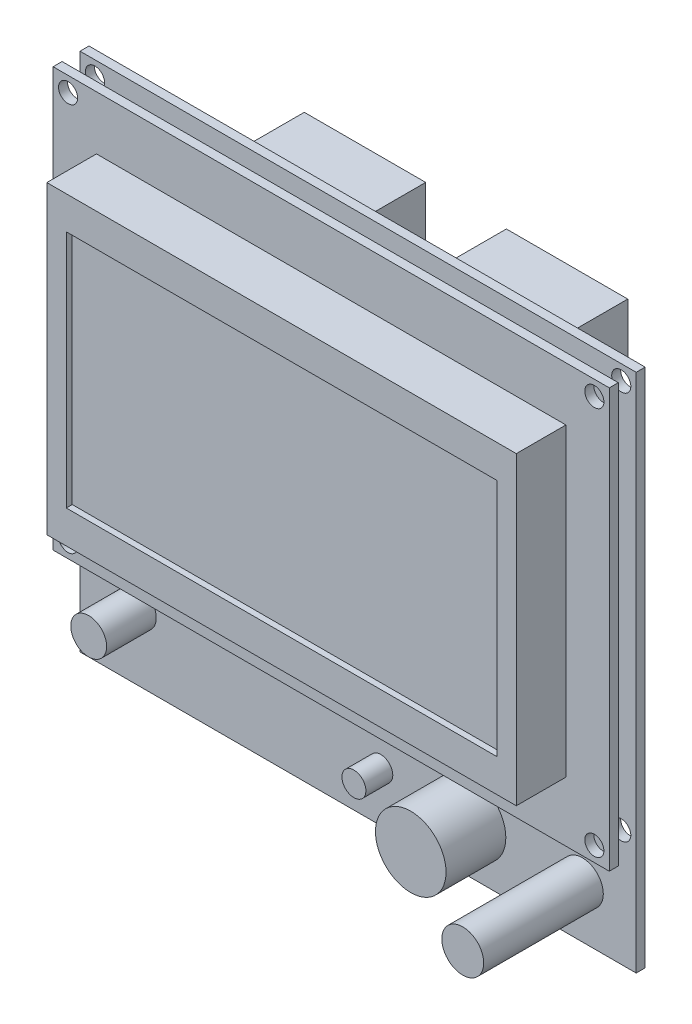
from build123d import *

# Parameters (mm, degrees)
ESBO_O1_W                  = 93
ESBO_O1_H                  = 87
RESSALTO_EXTRUS_O1_DEPTH   = 1.5
RESSALTO_EXTRUS_O2_START   = 3
ESBO_O3_W                  = 93
ESBO_O3_H                  = 70
RESSALTO_EXTRUS_O2_DEPTH   = 1.5
ESBO_O4_W                  = 78.5
ESBO_O4_H                  = 51
RESSALTO_EXTRUS_O3_DEPTH   = 8.3
ESBO_O5_W                  = 72
ESBO_O5_H                  = 40
CORTE_EXTRUS_O1_DEPTH      = 1
ESBO_O6_R                  = 3.5
RESSALTO_EXTRUS_O4_DEPTH   = 20
ESBO_O7_R                  = 2
RESSALTO_EXTRUS_O5_DEPTH   = 4.5
ESBO_O8_R                  = 5.9
RESSALTO_EXTRUS_O6_DEPTH   = 10
ESBO_O9_R                  = 3
RESSALTO_EXTRUS_O7_DEPTH   = 8.3
CORTE_EXTRUS_O2_DEPTH      = 66.534342142
CORTE_EXTRUS_O2_DEPTH_BACK = 66.534342142
ESBO_O10_R                 = 1.6
ESBO_O11_W                 = 20.3
ESBO_O11_H                 = 8.6
RESSALTO_EXTRUS_O8_DEPTH   = 15
ESBO_O12_W                 = 25.5
ESBO_O12_H                 = 26.5
RESSALTO_EXTRUS_O9_DEPTH   = 3


with BuildPart() as part:
    # Esboço1 → Ressalto-extrusão1 (new body)
    with BuildSketch(Plane.XY):
        Rectangle(ESBO_O1_W, ESBO_O1_H)
    extrude(amount=RESSALTO_EXTRUS_O1_DEPTH)

    # Esboço6 → Ressalto-extrusão4 (add)
    with BuildSketch(Plane.XY.offset(1.5)):
        with Locations((37.5, -34.8)):
            Circle(ESBO_O6_R)
    extrude(amount=RESSALTO_EXTRUS_O4_DEPTH)

    # Esboço7 → Ressalto-extrusão5 (add)
    with BuildSketch(Plane.XY.offset(1.5)):
        with Locations((3.8, -35.2)):
            Circle(ESBO_O7_R)
    extrude(amount=RESSALTO_EXTRUS_O5_DEPTH)

    # Esboço8 → Ressalto-extrusão6 (add)
    with BuildSketch(Plane.XY.offset(1.5)):
        with Locations((18.8, -34.8)):
            Circle(ESBO_O8_R)
    extrude(amount=RESSALTO_EXTRUS_O6_DEPTH)

    # Esboço9 → Ressalto-extrusão7 (add)
    with BuildSketch(Plane.XY.offset(1.5)):
        with Locations((-36.75, -32.2)):
            Circle(ESBO_O9_R)
    extrude(amount=RESSALTO_EXTRUS_O7_DEPTH)


with BuildPart() as body_2:
    # Esboço3 → Ressalto-extrusão2 (new body)
    with BuildSketch(Plane.XY.offset(1.5).offset(RESSALTO_EXTRUS_O2_START)):
        with Locations((0, 8.5)):
            Rectangle(ESBO_O3_W, ESBO_O3_H)
    extrude(amount=RESSALTO_EXTRUS_O2_DEPTH)

    # Esboço4 → Ressalto-extrusão3 (add)
    with BuildSketch(Plane.XY.offset(6)):
        with Locations((0, 9)):
            Rectangle(ESBO_O4_W, ESBO_O4_H)
    extrude(amount=RESSALTO_EXTRUS_O3_DEPTH)

    # Esboço5 → Corte-extrusão1 (cut)
    with BuildSketch(Plane.XY.offset(14.3)):
        with Locations((0, 9)):
            Rectangle(ESBO_O5_W, ESBO_O5_H)
    extrude(amount=-CORTE_EXTRUS_O1_DEPTH, mode=Mode.SUBTRACT)


with BuildPart() as corte_extrus_o2_tool:
    # Esboço10 → Corte-extrusão2 (new, two sides: drawn at the far end of the back side and taken through both)
    with BuildSketch(Plane.XY.offset(6).offset(-CORTE_EXTRUS_O2_DEPTH_BACK)):
        with Locations((-44, 41)):
            Circle(ESBO_O10_R)
        with Locations((44, 41)):
            Circle(ESBO_O10_R)
        with Locations((44, -24)):
            Circle(ESBO_O10_R)
        with Locations((-44, -24)):
            Circle(ESBO_O10_R)
    extrude(amount=CORTE_EXTRUS_O2_DEPTH + CORTE_EXTRUS_O2_DEPTH_BACK)


with BuildPart() as part_1:
    add(part.part)

    # Corte-extrusão2: cut by corte_extrus_o2_tool
    add(corte_extrus_o2_tool.part, mode=Mode.SUBTRACT)

    # Esboço11 → Ressalto-extrusão8 (add)
    with BuildSketch(Plane(origin=(0, 0, 0), x_dir=(-1, 0, 0), z_dir=(0, 0, -1))):
        with Locations((-18.438731824, 32.6)):
            Rectangle(ESBO_O11_W, ESBO_O11_H)
        with Locations((15.35, 32.6)):
            Rectangle(ESBO_O11_W, ESBO_O11_H)
    extrude(amount=RESSALTO_EXTRUS_O8_DEPTH)

    # Esboço12 → Ressalto-extrusão9 (add)
    with BuildSketch(Plane(origin=(0, 0, 0), x_dir=(-1, 0, 0), z_dir=(0, 0, -1))):
        with Locations((33.65, 8.25)):
            Rectangle(ESBO_O12_W, ESBO_O12_H)
    extrude(amount=RESSALTO_EXTRUS_O9_DEPTH)


with BuildPart() as body_2_1:
    add(body_2.part)

    # Corte-extrusão2: cut by corte_extrus_o2_tool
    add(corte_extrus_o2_tool.part, mode=Mode.SUBTRACT)


solid = Compound([part_1.part, body_2_1.part])
